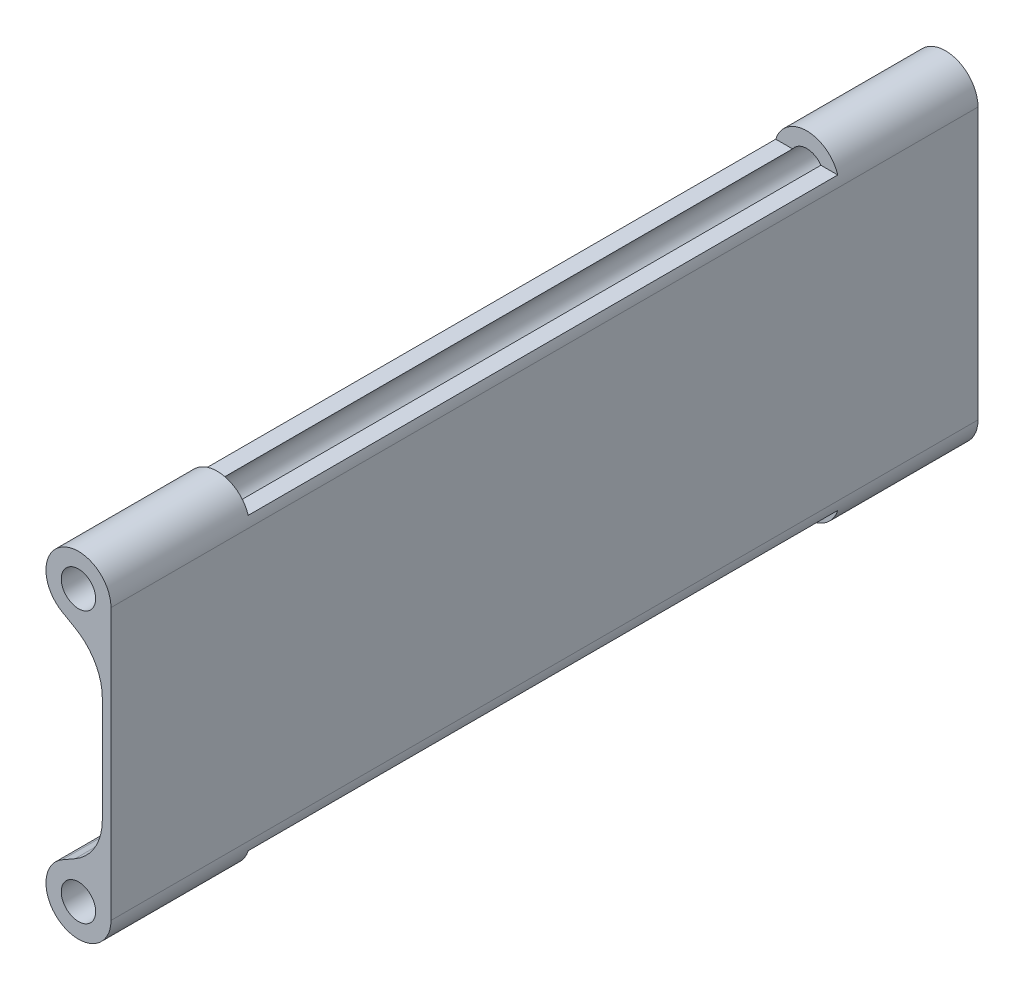
from build123d import *

# Parameters (mm, degrees)
CROQUIS1_R              = 3.175
SALIENTE_EXTRUIR1_DEPTH = 160
REDONDEO1_R             = 10
CROQUIS3_W              = 108.791812306
CROQUIS3_H              = 18.145434914
CORTAR_EXTRUIR2_DEPTH   = 164.416645419


with BuildPart() as part:
    # Croquis1 → Saliente-Extruir1 (new body)
    with BuildSketch(Plane.XY):
        with BuildLine():
            Line((-1.6, 15.556228096), (-8.98691391, 19.796314259))
            ThreePointArc((-8.98691391, 19.796314259), (-9.006535925, 30.19237342), (0, 25))
            Line((0, 25), (0, -25))
            ThreePointArc((0, -25), (-9.006535925, -30.19237342), (-8.98691391, -19.796314259))
            Line((-8.98691391, -19.796314259), (-1.6, -15.556228096))
            Line((-1.6, -15.556228096), (-1.6, 15.556228096))
        make_face()
        with Locations((-6, 25)):
            Circle(CROQUIS1_R, mode=Mode.SUBTRACT)
        with Locations((-6, -25)):
            Circle(CROQUIS1_R, mode=Mode.SUBTRACT)
    extrude(amount=-SALIENTE_EXTRUIR1_DEPTH)

    # Redondeo1
    redondeo1_edges = [part.edges().sort_by_distance(p)[0] for p in [
        (-1.6, -15.556228096, -80),
        (-1.6, 15.556228096, -80),
    ]]
    fillet(redondeo1_edges, radius=REDONDEO1_R)

    # Croquis3 → Cortar-Extruir2 (cut, through all)
    with BuildSketch(Plane(origin=(0, 0, 0), x_dir=(0, 0, -1), z_dir=(1, 0, 0))):
        with Locations((80, 35.875128035)):
            Rectangle(CROQUIS3_W, CROQUIS3_H)
        with Locations((80, -35.875128035)):
            Rectangle(CROQUIS3_W, CROQUIS3_H)
    extrude(amount=-CORTAR_EXTRUIR2_DEPTH, mode=Mode.SUBTRACT)


solid = part.part
